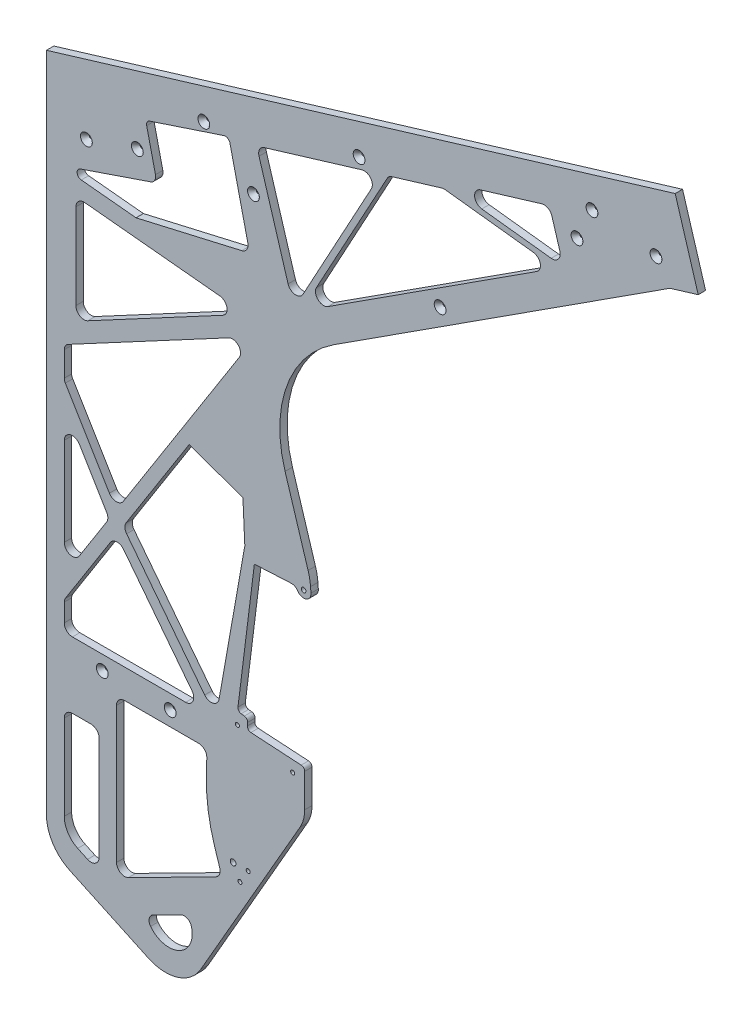
from build123d import *

# Parameters (mm, degrees)
SKETCH1_R                   = 2
BOSS_EXTRUDE1_DEPTH         = 6.35
F_8_CLEARANCE_HOLE1_D       = 4.9149
F_29_0_136_DIAMETER_HOLE1_D = 3.4544
FILLET2_R                   = 6.35
HOLE1_D                     = 3.175
HOLE1_DEPTH                 = 31.75
HOLE1_CSINK_D               = 10.16
HOLE1_CSINK_ANGLE           = 82
HOLE1_TIP                   = 0.953866233


with BuildPart() as part:
    # Sketch1 → Boss-Extrude1 (new body)
    with BuildSketch(Plane.XY):
        with BuildLine():
            Line((81.019658058, -168.897328822), (37.70615408, -166.236789132))
            ThreePointArc((37.70615408, -166.236789132), (35.522327499, -165.170958529), (34.731784962, -162.873103898))
            Line((34.731784962, -162.873103898), (34.902859203, -160.088020532))
            ThreePointArc((34.902859203, -160.088020532), (34.176628401, -157.865217786), (32.125295873, -156.742587798))
            Line((32.125295873, -156.742587798), (29.337293116, -156.396196072))
            ThreePointArc((29.337293116, -156.396196072), (27.224016083, -155.196548795), (26.577982286, -152.85395755))
            Line((26.577982286, -152.85395755), (40.701467954, -39.178272088))
            Line((40.701467954, -39.178272088), (72.307487293, -37.567416175))
            ThreePointArc((72.307487293, -37.567416175), (75.508274508, -38.248610367), (77.944821909, -40.433170067))
            ThreePointArc((77.944821909, -40.433170067), (80.37819882, -42.616116921), (83.575051255, -43.299282101))
            ThreePointArc((83.575051255, -43.299282101), (87.915366779, -41.106021585), (89.431266941, -36.48533146))
            Line((89.431266941, -36.48533146), (89.070856204, -31.748680417))
            ThreePointArc((89.070856204, -31.748680417), (88.331558939, -26.184805765), (86.9733286, -20.738846534))
            Line((86.9733286, -20.738846534), (67.150201914, 43.21421098))
            ThreePointArc((67.150201914, 43.21421098), (68.704153469, 107.993673093), (109.099933911, 158.658990615))
            Line((109.099933911, 158.658990615), (398.624090476, 345.521584423))
            Line((398.624090476, 345.521584423), (422.935039487, 352.879420939))
            Line((422.935039487, 352.879420939), (403.099057101, 418.419278389))
            Line((403.099057101, 418.419278389), (-138.378918258, 254.538122714))
            Line((-138.378918258, 254.538122714), (-138.378918258, -315.453385964))
            ThreePointArc((-138.378918258, -315.453385964), (-132.909364503, -334.218574785), (-118.213861049, -347.106185426))
            Line((-118.213861049, -347.106185426), (-50.505892811, -378.678929533))
            ThreePointArc((-50.505892811, -378.678929533), (-25.212372145, -380.324769115), (-5.467108781, -364.431514245))
            Line((-5.467108781, -364.431514245), (80.009026118, -215.73509408))
            ThreePointArc((80.009026118, -215.73509408), (82.985089128, -208.52137789), (84, -200.784155634))
            Line((84, -200.784155634), (84, -172.066355998))
            ThreePointArc((84, -172.066355998), (83.137862332, -169.891202478), (81.019658058, -168.897328822))
        make_face()
        with Locations((83.097986954, -37.255014564)):
            Circle(SKETCH1_R, mode=Mode.SUBTRACT)
        with BuildLine():
            Line((-17.052845203, -329.494257158), (-52.060968117, -347.265819105))
            ThreePointArc((-52.060968117, -347.265819105), (-23.771187013, -359.626780553), (-17.052845203, -329.494257158))
        make_face(mode=Mode.SUBTRACT)
        with BuildLine():
            Line((-123, -235.789377226), (-123, -309.069613992))
            ThreePointArc((-123, -309.069613992), (-119.867828916, -319.815606158), (-111.452365235, -327.195769732))
            Line((-111.452365235, -327.195769732), (-102.958327832, -331.156604422))
            ThreePointArc((-102.958327832, -331.156604422), (-96.238902742, -330.716190033), (-93, -324.812449913))
            Line((-93, -324.812449913), (-93, -235.789377226))
            ThreePointArc((-93, -235.789377226), (-95.050252532, -230.839629758), (-100, -228.789377226))
            Line((-100, -228.789377226), (-116, -228.789377226))
            ThreePointArc((-116, -228.789377226), (-120.949747468, -230.839629758), (-123, -235.789377226))
        make_face(mode=Mode.SUBTRACT)
        with BuildLine():
            Line((-61.199770062, 168.179421619), (29.826630294, 189.194522014))
            ThreePointArc((29.826630294, 189.194522014), (34.188309587, 192.305677618), (35.072563367, 197.589769848))
            Line((35.072563367, 197.589769848), (19.638832994, 264.440600612))
            ThreePointArc((19.638832994, 264.440600612), (17.700947347, 267.027913965), (14.483251541, 267.337792758))
            Line((14.483251541, 267.337792758), (-49.392848873, 246.173011312))
            ThreePointArc((-49.392848873, 246.173011312), (-51.62186525, 244.335609561), (-52.032227939, 241.476210731))
            Line((-52.032227939, 241.476210731), (-43.179065741, 203.128952263))
            Line((-43.179065741, 203.128952263), (-109.246803026, 180.591656302))
            ThreePointArc((-109.246803026, 180.591656302), (-111.928836089, 176.345829111), (-108.347619238, 172.825142281))
            Line((-108.347619238, 172.825142281), (-61.199770062, 168.179421619))
        make_face(mode=Mode.SUBTRACT)
        with BuildLine():
            Line((-102.695777716, 70.621262325), (13.547329865, 132.862172762))
            ThreePointArc((13.547329865, 132.862172762), (17.10814199, 140.401199203), (10.929529426, 145.999506934))
            Line((10.929529426, 145.999506934), (-105.313578156, 157.453539643))
            ThreePointArc((-105.313578156, 157.453539643), (-110.700800309, 155.67403602), (-113, 150.487276294))
            Line((-113, 150.487276294), (-113, 76.792333148))
            ThreePointArc((-113, 76.792333148), (-109.596556966, 70.786937408), (-102.695777716, 70.621262325))
        make_face(mode=Mode.SUBTRACT)
        with BuildLine():
            Line((-123, -28.654884494), (-123, -104.746758641))
            ThreePointArc((-123, -104.746758641), (-117.95351244, -111.468647449), (-110.090345958, -108.498556757))
            Line((-110.090345958, -108.498556757), (-86.579188082, -71.464898525))
            ThreePointArc((-86.579188082, -71.464898525), (-85.489337935, -67.796413702), (-86.491561629, -64.103027464))
            Line((-86.491561629, -64.103027464), (-110.002719505, -25.044811549))
            ThreePointArc((-110.002719505, -25.044811549), (-117.87337083, -21.91022129), (-123, -28.654884494))
        make_face(mode=Mode.SUBTRACT)
        with BuildLine():
            Line((-78, -203.789377226), (-78, -320.992945508))
            ThreePointArc((-78, -320.992945508), (-74.661956673, -326.958687149), (-67.831407622, -327.234741912))
            Line((-67.831407622, -327.234741912), (7.408132297, -289.040059271))
            ThreePointArc((7.408132297, -289.040059271), (10.698904711, -285.495781445), (10.90617564, -280.663791466))
            Line((10.90617564, -280.663791466), (6.494444344, -266.884545968))
            ThreePointArc((6.494444344, -266.884545968), (0.856780444, -242.347035927), (-0.59748893, -217.212244226))
            Line((-0.59748893, -217.212244226), (-0.250179597, -203.972946573))
            ThreePointArc((-0.250179597, -203.972946573), (-2.23354318, -198.904962493), (-7.247772204, -196.789377226))
            Line((-7.247772204, -196.789377226), (-71, -196.789377226))
            ThreePointArc((-71, -196.789377226), (-75.949747468, -198.839629758), (-78, -203.789377226))
        make_face(mode=Mode.SUBTRACT)
        with BuildLine():
            Line((-15.470800679, 21.883932686), (-69.688252467, -63.516820026))
            ThreePointArc((-69.688252467, -63.516820026), (-70.770838401, -67.598133112), (-69.309232347, -71.559549091))
            Line((-69.309232347, -71.559549091), (-2.107117722, -158.177185032))
            ThreePointArc((-2.107117722, -158.177185032), (5.104316904, -160.681466294), (10.316757622, -155.104130392))
            Line((10.316757622, -155.104130392), (32.484613968, -29.632943931))
            Line((32.484613968, -29.632943931), (30.845296938, 5.564557689))
            Line((30.845296938, 5.564557689), (-15.470800679, 21.883932686))
        make_face(mode=Mode.SUBTRACT)
        with BuildLine():
            Line((-83.358453873, -85.049471439), (-123, -147.490950451))
            Line((-123, -147.490950451), (-123, -164.789377226))
            ThreePointArc((-123, -164.789377226), (-120.949747468, -169.739124694), (-116, -171.789377226))
            Line((-116, -171.789377226), (-18.493582843, -171.789377226))
            ThreePointArc((-18.493582843, -171.789377226), (-12.207227911, -167.868620912), (-12.96294892, -160.498446277))
            Line((-12.96294892, -160.498446277), (-71.918165908, -84.510338605))
            ThreePointArc((-71.918165908, -84.510338605), (-77.778314802, -81.809029579), (-83.358453873, -85.049471439))
        make_face(mode=Mode.SUBTRACT)
        with BuildLine():
            Line((18.511705321, 118.505409967), (-123, 42.734746572))
            Line((-123, 42.734746572), (-123, 15.937279137))
            Line((-123, 15.937279137), (-84.107110781, -48.674037444))
            ThreePointArc((-84.107110781, -48.674037444), (-78.19314358, -52.063468688), (-72.200176244, -48.815762615))
            Line((-72.200176244, -48.815762615), (27.725581647, 108.582541028))
            ThreePointArc((27.725581647, 108.582541028), (26.945537791, 117.097436807), (18.511705321, 118.505409967))
        make_face(mode=Mode.SUBTRACT)
        with BuildLine():
            Line((236.55061974, 323.649776269), (296.321562944, 316.742770836))
            ThreePointArc((296.321562944, 316.742770836), (302.497167394, 319.208610524), (303.824943291, 325.724396498))
            Line((303.824943291, 325.724396498), (296.893445901, 348.624831151))
            ThreePointArc((296.893445901, 348.624831151), (293.497171214, 352.7683627), (288.165723096, 353.296753095))
            Line((288.165723096, 353.296753095), (235.326277282, 337.303323874))
            ThreePointArc((235.326277282, 337.303323874), (230.38215292, 329.978305308), (236.55061974, 323.649776269))
        make_face(mode=Mode.SUBTRACT)
        with BuildLine():
            Line((104.123887079, 184.645888182), (283.866191841, 300.659579208))
            ThreePointArc((283.866191841, 300.659579208), (286.887290545, 308.13032685), (280.873685483, 313.494621944))
            Line((280.873685483, 313.494621944), (203.475200181, 322.438629347))
            Line((203.475200181, 322.438629347), (156.4343015, 308.200302809))
            Line((156.4343015, 308.200302809), (94.180176407, 193.874808481))
            ThreePointArc((94.180176407, 193.874808481), (95.565919036, 185.396487117), (104.123887079, 184.645888182))
        make_face(mode=Mode.SUBTRACT)
        with BuildLine():
            Line((44.70581348, 267.068727432), (69.739941264, 184.360421397))
            ThreePointArc((69.739941264, 184.360421397), (75.724481753, 179.424962594), (82.587409979, 183.040719033))
            Line((82.587409979, 183.040719033), (141.453242141, 291.143842337))
            ThreePointArc((141.453242141, 291.143842337), (140.735215006, 298.909502995), (133.27769537, 301.191267506))
            Line((133.27769537, 301.191267506), (49.377735423, 275.796450237))
            ThreePointArc((49.377735423, 275.796450237), (45.234203874, 272.40017555), (44.70581348, 267.068727432))
        make_face(mode=Mode.SUBTRACT)
    extrude(amount=BOSS_EXTRUDE1_DEPTH)

    # #8 Clearance Hole1 (through all)
    with Locations(Plane.XY.offset(6.35)):
        with Locations((22.417305887, -270.769233836)):
            Hole(F_8_CLEARANCE_HOLE1_D / 2)

    # #29 (0.136) Diameter Hole1 (through all)
    with Locations(Plane.XY.offset(6.35)):
        with Locations((28.303582289, -282.335622674), (35.395348907, -270.769233836), (26.084910743, -166.378822149), (73.686163127, -178.091324216)):
            Hole(F_29_0_136_DIAMETER_HOLE1_D / 2)

    # Fillet2
    fillet2_edges = [part.edges().sort_by_distance(p)[0] for p in [
        (-52.060968117, -347.265819105, 3.175),
        (-17.052845203, -329.494257158, 3.175),
        (-123, -147.490950451, 3.175),
        (-123, 15.937279137, 3.175),
        (-123, 42.734746572, 3.175),
        (-43.179065741, 203.128952263, 3.175),
        (156.4343015, 308.200302809, 3.175),
        (203.475200181, 322.438629347, 3.175),
    ]]
    fillet(fillet2_edges, radius=FILLET2_R)

    # Hole1
    with Locations(Plane(origin=(-277.286738577, -215.287141225, 6.35), x_dir=(-0.08995962873759034, -0.9959454127598536, 0), z_dir=(0, 0, 1))):
        with Locations((-507.038658285, 229.776136946), (-559.371199386, 359.303721429), (-637.870011036, 553.595098153), (-636.071223534, 609.111420407), (-609.449424187, 543.22015483), (-488.870508314, 435.756794718), (-478.414399376, 275.292665941), (-453.103621196, 177.188747915), (-434.459074831, 134.806234549), (-52.960474704, 241.752641108), (-47.697836423, 183.489834462)):
            CounterSinkHole(HOLE1_D / 2, HOLE1_CSINK_D / 2, depth=HOLE1_DEPTH, counter_sink_angle=HOLE1_CSINK_ANGLE)
            with Locations((0, 0, -(HOLE1_DEPTH + HOLE1_TIP / 2))):  # 118° drill point
                Cone(0, HOLE1_D / 2, HOLE1_TIP, mode=Mode.SUBTRACT)


solid = part.part
